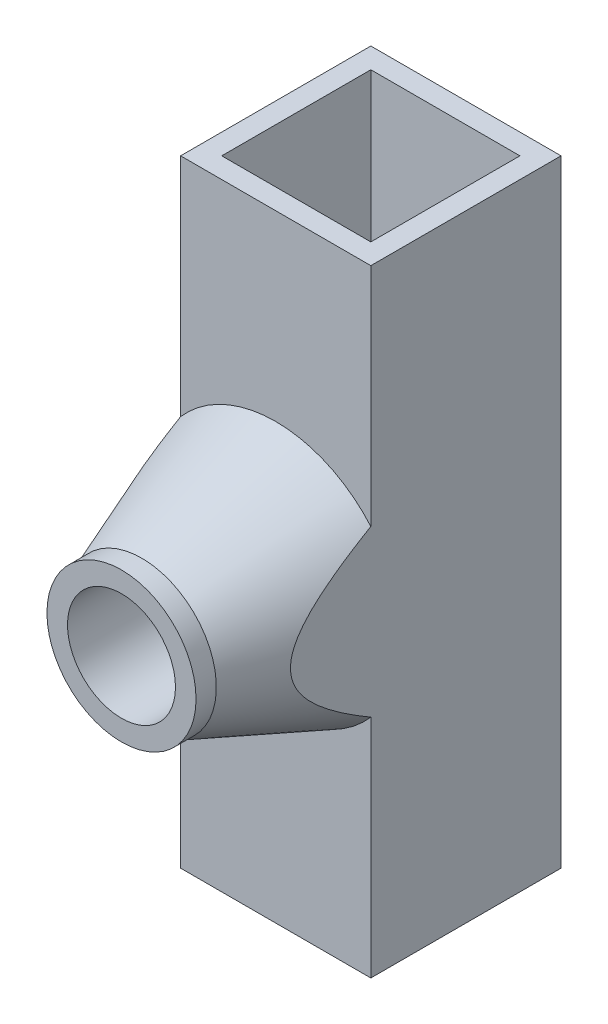
from build123d import *

# Parameters (mm, degrees)
SKETCH1_W           = 18.5
SKETCH1_H           = 18.5
SKETCH1_W_2         = 14.5
SKETCH1_H_2         = 14.5
BOSS_EXTRUDE1_DEPTH = 60
SKETCH2_R           = 7.25
SKETCH2_R_2         = 5.25
BOSS_EXTRUDE2_DEPTH = 15
CHAMFER1_SIZE       = 5
CHAMFER1_SIZE_2     = 13.025445323


with BuildPart() as part:
    # Sketch1 → Boss-Extrude1 (new body)
    with BuildSketch(Plane(origin=(0, 0, 0), x_dir=(1, 0, 0), z_dir=(0, 1, 0))):
        Rectangle(SKETCH1_W, SKETCH1_H)
        Rectangle(SKETCH1_W_2, SKETCH1_H_2, mode=Mode.SUBTRACT)
    extrude(amount=BOSS_EXTRUDE1_DEPTH)

    # Sketch2 → Boss-Extrude2 (add)
    with BuildSketch(Plane.XY.offset(9.25)):
        with Locations(Location((0, 30, 0), (0, 0, 180))):
            Circle(SKETCH2_R)
        with Locations((0, 30)):
            Circle(SKETCH2_R_2, mode=Mode.SUBTRACT)
    extrude(amount=BOSS_EXTRUDE2_DEPTH)

    # Chamfer1
    # the kernel refuses this chamfer: 13.025445323, 5 mm, written as the material it adds along each edge
    with BuildSketch(Plane(origin=(0, 30, 9.25), x_dir=(-1, 0, 0), z_dir=(0, 1, 0))) as chamfer1_piece_1_section:
        Polygon((7.25 + CHAMFER1_SIZE, 0), (7.25, CHAMFER1_SIZE_2), (7.25, 0), align=None)
    chamfer1_piece_1 = revolve(axis=Axis((0, 30, 9.25), (0, 0, 1)), mode=Mode.PRIVATE)
    chamfer1_piece_1 = split(chamfer1_piece_1, bisect_by=Plane(origin=(-9.25, 20.104834993, 11.052414917), z_dir=(1, 0, 0)), keep=Keep.TOP, mode=Mode.PRIVATE)
    chamfer1_piece_1 = split(chamfer1_piece_1, bisect_by=Plane(origin=(9.25, 20.104834993, 11.052414917), z_dir=(-1, 0, 0)), keep=Keep.TOP, mode=Mode.PRIVATE)
    add(chamfer1_piece_1)


solid = part.part
